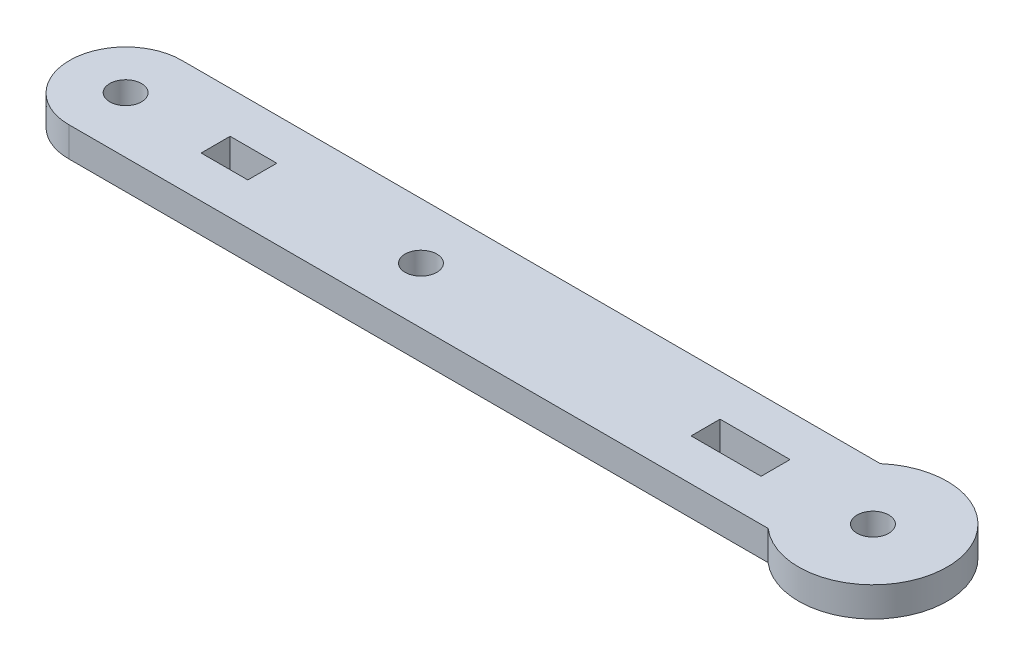
from build123d import *

# Parameters (mm, degrees)
SKETCH1_R           = 1.7
SKETCH1_W           = 7.486730502
SKETCH1_H           = 3.100058143
BOSS_EXTRUDE1_DEPTH = 3.175


with BuildPart() as part:
    # Sketch1 → Boss-Extrude1 (new body)
    with BuildSketch(Plane(origin=(0, 0, 0), x_dir=(1, 0, 0), z_dir=(0, 1, 0))):
        with BuildLine():
            Line((-1.718942995, 1.149571336), (-76.520317967, 1.150079187))
            add(Edge.make_bspline(
                [(-76.520317967, 1.150079187), (-79.828148149, 1.150079187), (-82.430527822, 3.835968062), (-82.430527822, 7.14979099)],
                knots=[2, 2, 2, 2, 3, 3, 3, 3], degree=3))
            add(Edge.make_bspline(
                [(-82.430527822, 7.14979099), (-82.430527822, 10.463613917), (-79.748989201, 13.150069237), (-76.441159018, 13.150069237)],
                knots=[3, 3, 3, 3, 4, 4, 4, 4], degree=3))
            Line((-76.441159018, 13.150069237), (-1.718942994, 13.150069237))
            ThreePointArc((-1.718942994, 13.150069237), (11.441426967, 7.149820286), (-1.718942995, 1.149571336))
        make_face()
        with Locations((3.49338578, 7.149820286)):
            Circle(SKETCH1_R, mode=Mode.SUBTRACT)
        with Locations((-44.853504279, 7.149793405)):
            Circle(SKETCH1_R, mode=Mode.SUBTRACT)
        with Locations((-76.441159018, 7.149790989)):
            Circle(SKETCH1_R, mode=Mode.SUBTRACT)
        Polygon((-66.814399742, 8.649858084), (-66.814399742, 8.69992014), (-61.823223328, 8.69992014), (-61.823223328, 8.649858084), (-61.823223328, 5.649728727), (-61.823223328, 5.599861997), (-66.814399742, 5.599861997), (-66.814399742, 5.649728727), align=None, mode=Mode.SUBTRACT)
        with Locations((-10.663979471, 7.149891067)):
            Rectangle(SKETCH1_W, SKETCH1_H, mode=Mode.SUBTRACT)
    extrude(amount=BOSS_EXTRUDE1_DEPTH)


solid = part.part
